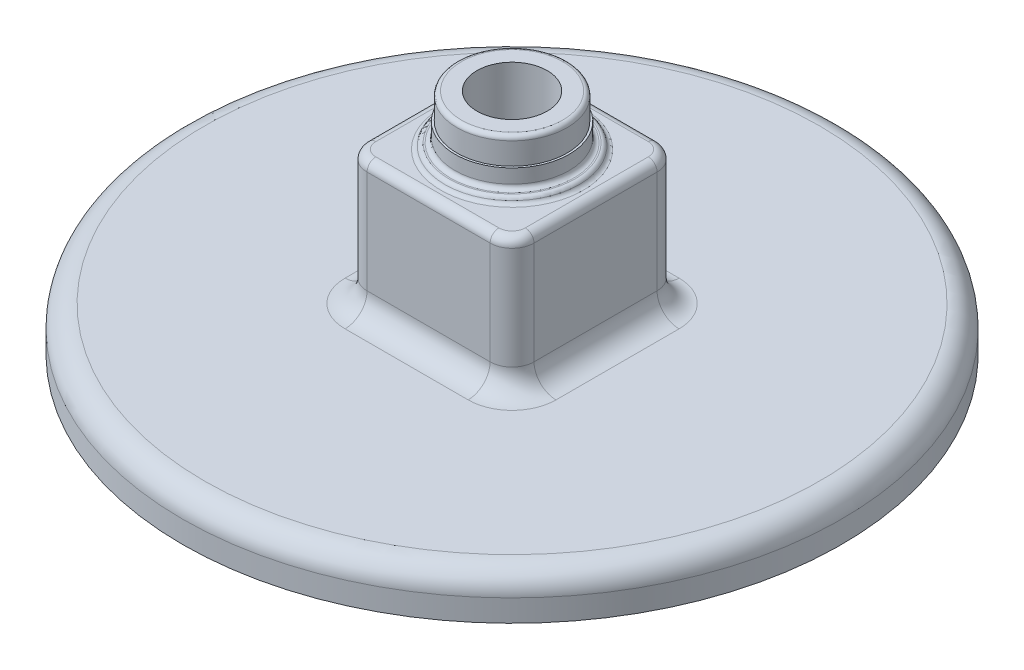
from build123d import *

# Parameters (mm, degrees)
SKETCH1_W      = 380
SKETCH1_H      = 380
EXTRUDE1_DEPTH = 404
SKETCH4_R      = 750
EXTRUDE2_DEPTH = 100
FILLET1_R      = 50
FILLET2_R      = 50
FILLET3_R      = 50
FILLET4_R      = 20
FILLET5_R      = 10
FILLET6_R      = 10
FILLET7_R      = 10
SCALE1_SCALE   = 0.1


with BuildPart() as part:
    # Sketch1 → Extrude1 (new body)
    with BuildSketch(Plane(origin=(0, 0, 0), x_dir=(1, 0, 0), z_dir=(0, 1, 0))):
        Rectangle(SKETCH1_W, SKETCH1_H)
    extrude(amount=EXTRUDE1_DEPTH)

    # Sketch4 → Extrude2 (add)
    with BuildSketch(Plane(origin=(0, 0, 0), x_dir=(1, 0, 0), z_dir=(0, 1, 0))):
        Circle(SKETCH4_R)
    extrude(amount=EXTRUDE2_DEPTH)

    # Fillet1
    fillet1_edges = [part.edges().sort_by_distance(p)[0] for p in [
        (-190, 252, 190),
        (-190, 252, -190),
        (190, 252, -190),
        (190, 252, 190),
    ]]
    fillet(fillet1_edges, radius=FILLET1_R)

    # Sketch2 → Revolve1 (revolve)
    with BuildSketch(Plane(origin=(0, 0, 0), x_dir=(0, 0, -1), z_dir=(1, 0, 0))):
        Polygon((125.25, 459), (130, 459), (130, 417), (152, 417), (152, 404), (0, 404), (0, 519), (125.25, 519), align=None)
    revolve(axis=Axis((0, 0, 0), (0, 1, 0)))

    # Sketch3 → Cut-Revolve1 (revolve, cut)
    with BuildSketch(Plane(origin=(0, 0, 0), x_dir=(0, 0, -1), z_dir=(1, 0, 0))):
        Polygon((0, 519), (80, 519), (80, 269), (17.5, 269), (17.5, 169), (40, 169), (40, 0), (0, 0), align=None)
    revolve(axis=Axis((0, 0, 0), (0, 1, 0)), mode=Mode.SUBTRACT)

    # Fillet2
    fillet2_edges = [part.edges().sort_by_distance(p)[0] for p in [
        (-750, 100, 0),
    ]]
    fillet(fillet2_edges, radius=FILLET2_R)

    # Fillet3
    fillet3_edges = [part.edges().sort_by_distance(p)[0] for p in [
        (175.355339059, 100, 175.355339059),
        (0, 100, 190),
        (-175.355339059, 100, 175.355339059),
        (-190, 100, 0),
        (-175.355339059, 100, -175.355339059),
        (0, 100, -190),
        (175.355339059, 100, -175.355339059),
        (190, 100, 0),
    ]]
    fillet(fillet3_edges, radius=FILLET3_R)

    # Fillet4
    fillet4_edges = [part.edges().sort_by_distance(p)[0] for p in [
        (175.355339059, 404, 175.355339059),
        (0, 404, 190),
        (-175.355339059, 404, 175.355339059),
        (-190, 404, 0),
        (-175.355339059, 404, -175.355339059),
        (0, 404, -190),
        (175.355339059, 404, -175.355339059),
        (190, 404, 0),
    ]]
    fillet(fillet4_edges, radius=FILLET4_R)

    # Fillet5
    fillet5_edges = [part.edges().sort_by_distance(p)[0] for p in [
        (0, 519, 125.25),
    ]]
    fillet(fillet5_edges, radius=FILLET5_R)

    # Fillet6
    fillet6_edges = [part.edges().sort_by_distance(p)[0] for p in [
        (0, 417, 130),
        (0, 404, 152),
    ]]
    fillet(fillet6_edges, radius=FILLET6_R)

    # Fillet7
    fillet7_edges = [part.edges().sort_by_distance(p)[0] for p in [
        (0, 417, 152),
    ]]
    fillet(fillet7_edges, radius=FILLET7_R)


with BuildPart() as part_1:
    # Scale1: scaled about (0, 0, 0)
    add(part.part.scale(SCALE1_SCALE))


solid = part_1.part
